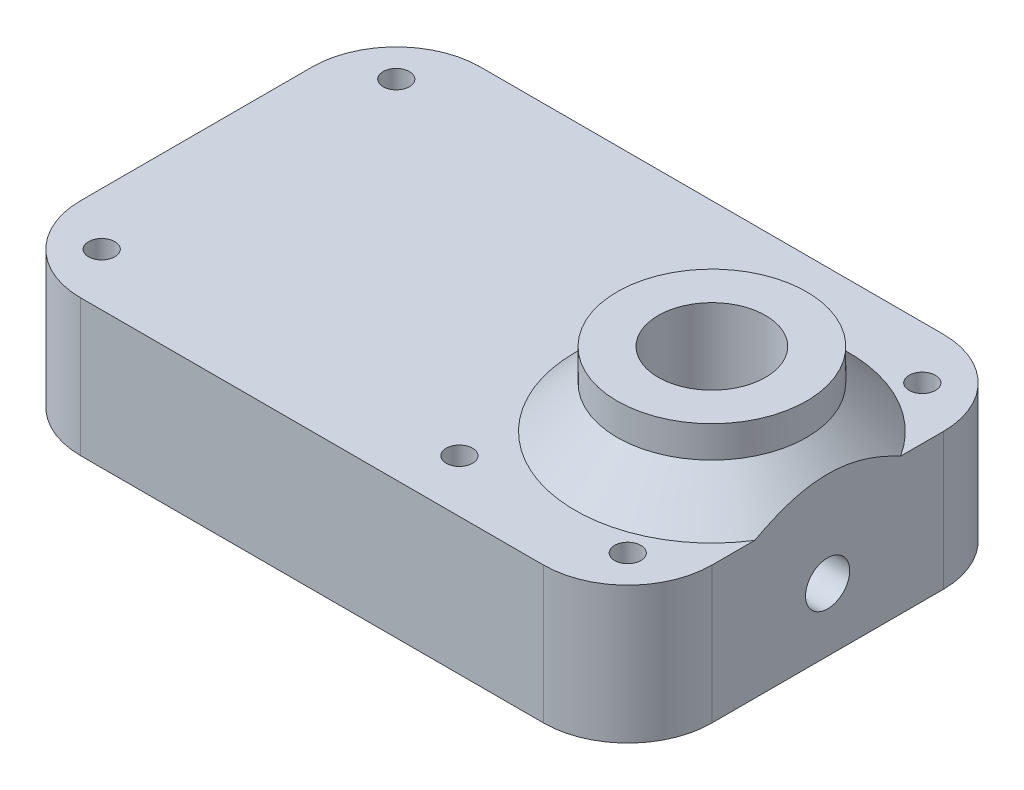
from build123d import *

# Parameters (mm, degrees)
SKETCH1_W                               = 60
SKETCH1_H                               = 38
BASE_DEPTH                              = 13
ADDALITTLEBEAUTY_R                      = 8
SKETCH1_3_R                             = 9
RODHOLDER_DEPTH                         = 20
M5X0_8_TAPPED_HOLE_FOR_FIXING_ROD_D     = 4.2
M5X0_8_TAPPED_HOLE_FOR_FIXING_ROD_DEPTH = 10.4
M5X0_8_TAPPED_HOLE_FOR_FIXING_ROD_TIP   = 1.2618073
CHAMFER1_SIZE                           = 4
F_10_2_10_2_ROD_HOLE_D                  = 10.2
M3X0_5_TAPPED_HOLE1_D                   = 2.5
M3X0_5_TAPPED_HOLE1_CSINK_D             = 3.05
M3X0_5_TAPPED_HOLE1_CSINK_ANGLE         = 90
SKETCH9_W                               = 27
SKETCH9_H                               = 27
CUT_EXTRUDE1_DEPTH                      = 9
FILLET1_R                               = 2


with BuildPart() as part:
    # Sketch1 → Base (new body)
    with BuildSketch(Plane(origin=(0, 0, 0), x_dir=(1, 0, 0), z_dir=(0, 1, 0))):
        with Locations((-19, 0)):
            Rectangle(SKETCH1_W, SKETCH1_H)
    extrude(amount=BASE_DEPTH)

    # AddALittleBeauty
    addalittlebeauty_edges = [part.edges().sort_by_distance(p)[0] for p in [
        (11, 6.5, -19),
        (11, 6.5, 19),
        (-49, 6.5, 19),
        (-49, 6.5, -19),
    ]]
    fillet(addalittlebeauty_edges, radius=ADDALITTLEBEAUTY_R)

    # Sketch1<3> → RodHolder (add)
    with BuildSketch(Plane(origin=(0, 0, 0), x_dir=(1, 0, 0), z_dir=(0, 1, 0))):
        with Locations(Location((0, 0, 0), (0, 0, 270))):
            Circle(SKETCH1_3_R)
    extrude(amount=RODHOLDER_DEPTH)

    # M5x0.8 Tapped Hole for fixing rod
    with Locations(Plane(origin=(11, 0, 0), x_dir=(0, 0, -1), z_dir=(1, 0, 0))):
        with Locations((0, 6)):
            Hole(M5X0_8_TAPPED_HOLE_FOR_FIXING_ROD_D / 2, depth=M5X0_8_TAPPED_HOLE_FOR_FIXING_ROD_DEPTH)
            with Locations((0, 0, -(M5X0_8_TAPPED_HOLE_FOR_FIXING_ROD_DEPTH + M5X0_8_TAPPED_HOLE_FOR_FIXING_ROD_TIP / 2))):  # 118° drill point
                Cone(0, M5X0_8_TAPPED_HOLE_FOR_FIXING_ROD_D / 2, M5X0_8_TAPPED_HOLE_FOR_FIXING_ROD_TIP, mode=Mode.SUBTRACT)

    # Chamfer1
    # the kernel refuses this chamfer: 4 mm, written as the material it adds along each edge
    with BuildSketch(Plane(origin=(0, 13, 0), x_dir=(0, 0, 1), z_dir=(1, 0, 0))) as chamfer1_piece_1_section:
        Polygon((9 + CHAMFER1_SIZE, 0), (9, -CHAMFER1_SIZE), (9, 0), align=None)
    chamfer1_piece_1 = revolve(axis=Axis((0, 13, 0), (0, -1, 0)), mode=Mode.PRIVATE)
    chamfer1_piece_1 = split(chamfer1_piece_1, bisect_by=Plane(origin=(11, 14.941949716, -10.941949716), z_dir=(-1, 0, 0)), keep=Keep.TOP, mode=Mode.PRIVATE)
    add(chamfer1_piece_1)

    # Ø10.2 (10.2) Rod Hole (through all)
    with Locations(Plane(origin=(0, 20, 0), x_dir=(1, 0, 0), z_dir=(0, 1, 0))):
        with Locations((0, 0)):
            Hole(F_10_2_10_2_ROD_HOLE_D / 2)

    # M3x0.5 Tapped Hole1 (through all)
    with Locations(Plane(origin=(0, 0, 0), x_dir=(-1, 0, 0), z_dir=(0, -1, 0))):
        with Locations((-6, 14), (-6, -14), (44, -14), (44, 14), (10, 14), (10, -14)):
            CounterSinkHole(M3X0_5_TAPPED_HOLE1_D / 2, M3X0_5_TAPPED_HOLE1_CSINK_D / 2, counter_sink_angle=M3X0_5_TAPPED_HOLE1_CSINK_ANGLE)

    # Sketch9 → Cut-Extrude1 (cut)
    with BuildSketch(Plane.XZ):
        with Locations((-27, 0)):
            Rectangle(SKETCH9_W, SKETCH9_H)
    extrude(amount=-CUT_EXTRUDE1_DEPTH, mode=Mode.SUBTRACT)

    # Fillet1
    fillet1_edges = [part.edges().sort_by_distance(p)[0] for p in [
        (-40.5, 9, 0),
        (-40.5, 4.5, -13.5),
        (-27, 9, 13.5),
        (-40.5, 4.5, 13.5),
        (-13.5, 9, 0),
        (-13.5, 4.5, 13.5),
        (-27, 9, -13.5),
        (-13.5, 4.5, -13.5),
    ]]
    fillet(fillet1_edges, radius=FILLET1_R)


solid = part.part
